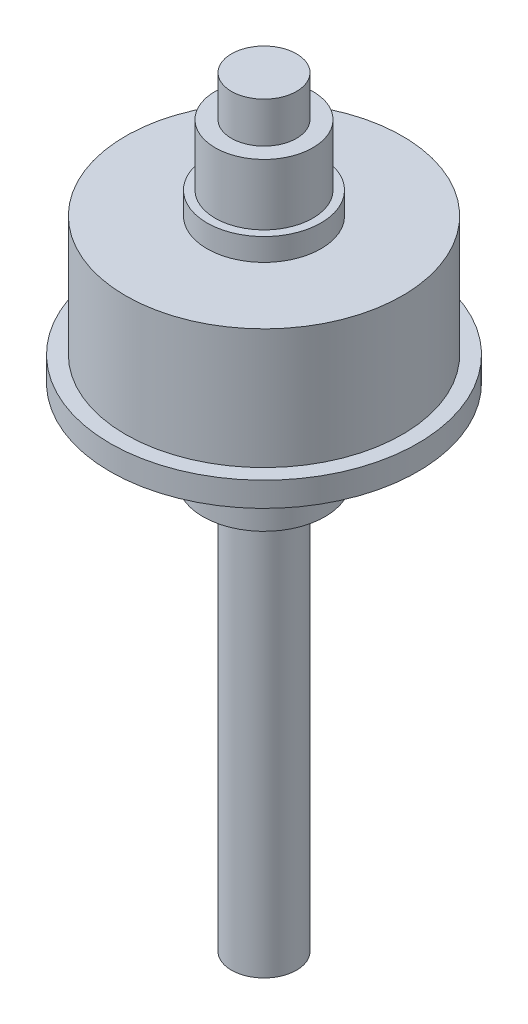
from build123d import *


with BuildPart() as part:
    # Sketch2 → Revolve1 (revolve)
    with BuildSketch(Plane.XY):
        Polygon((0, 0), (-4, 0), (-4, -5), (-6, -5), (-6, -12.5), (-7, -12.5), (-7, -15.25), (-17, -15.25), (-17, -30.01), (-18.9, -30.01), (-18.9, -33.01), (-9, -33.01), (-9, -35.51), (-7.5, -35.51), (-7.5, -43.51), (-4, -43.51), (-4, -93.51), (0, -93.51), align=None)
    revolve(axis=Axis((0, 40.033449689, 0), (0, -1, 0)))


solid = part.part
